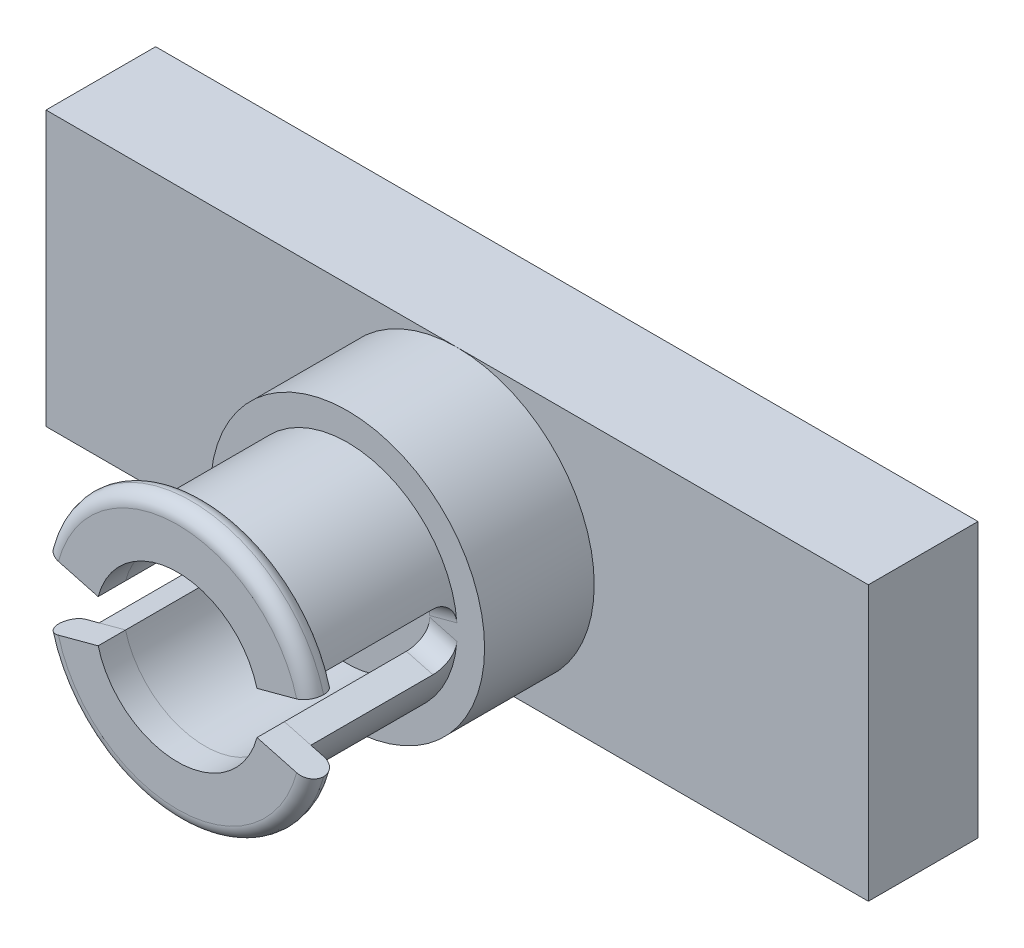
from build123d import *

# Parameters (mm, degrees)
SKETCH1_W             = 30
SKETCH1_H             = 4
BOSS_EXTRUDE1_DEPTH   = 10
SKETCH2_R             = 5
SKETCH2_R_2           = 4
BOSS_EXTRUDE2_DEPTH   = 4
BOSS_EXTRUDE3_DEPTH   = 5.2
BOSS_EXTRUDE5_DEPTH   = 1
BOSS_EXTRUDE5_2_DEPTH = 1
FILLET2_R             = 0.75
FILLET3_R             = 0.5
FILLET4_R             = 0.5


with BuildPart() as part:
    # Sketch1 → Boss-Extrude1 (new body)
    with BuildSketch(Plane(origin=(0, -120.095456241, 0), x_dir=(1, 0, 0), z_dir=(0, 1, 0))):
        with Locations((36.874415609, -119.024132807)):
            Rectangle(SKETCH1_W, SKETCH1_H)
    extrude(amount=BOSS_EXTRUDE1_DEPTH)

    # Sketch2 → Boss-Extrude2 (add)
    # profile 1 of 2: a face of its own
    with BuildSketch(Plane.XY.offset(121.024132807)):
        with Locations(Location((36.874415609, -115.095456241, 0), (0, 0, 270))):
            Circle(SKETCH2_R)
        with Locations((36.874415609, -115.095456241)):
            Circle(SKETCH2_R_2, mode=Mode.SUBTRACT)
    # profile 2 of 2: a face of its own
    with BuildSketch(Plane.XY.offset(121.024132807)):
        with Locations((36.874415609, -115.095456241)):
            Circle(SKETCH2_R_2)
    extrude(amount=BOSS_EXTRUDE2_DEPTH)

    # Sketch3 → Boss-Extrude3 (add)
    with BuildSketch(Plane.XY.offset(125.024132807)):
        with BuildLine():
            ThreePointArc((33.97663813, -114.318999106), (36.874415609, -112.095456241), (39.772193088, -114.318999106))
            Line((39.772193088, -114.318999106), (40.738118914, -114.060180061))
            ThreePointArc((40.738118914, -114.060180061), (36.874415609, -111.095456241), (33.010712304, -114.060180061))
            Line((33.010712304, -114.060180061), (33.97663813, -114.318999106))
        make_face()
        with BuildLine():
            Line((40.738118914, -116.130732422), (39.772193088, -115.871913377))
            ThreePointArc((39.772193088, -115.871913377), (36.874415609, -118.095456241), (33.97663813, -115.871913377))
            Line((33.97663813, -115.871913377), (33.010712304, -116.130732422))
            ThreePointArc((33.010712304, -116.130732422), (36.874415609, -119.095456241), (40.738118914, -116.130732422))
        make_face()
    extrude(amount=BOSS_EXTRUDE3_DEPTH)

    # Fillet2
    fillet2_edges = [part.edges().sort_by_distance(p)[0] for p in [
        (40.255156001, -114.189589584, 125.024132807),
        (33.493675217, -114.189589584, 125.024132807),
        (40.255156001, -116.001322899, 125.024132807),
        (33.493675217, -116.001322899, 125.024132807),
    ]]
    fillet(fillet2_edges, radius=FILLET2_R)


with BuildPart() as body_2:
    # Sketch5 → Boss-Extrude5 (new body)
    with BuildSketch(Plane.XY.offset(130.224132807)):
        with BuildLine():
            Line((33.010712304, -114.060180061), (33.97663813, -114.318999106))
            ThreePointArc((33.97663813, -114.318999106), (36.874415609, -112.095456241), (39.772193088, -114.318999106))
            Line((39.772193088, -114.318999106), (40.738118914, -114.060180061))
            Line((40.738118914, -114.060180061), (41.704044741, -113.801361016))
            ThreePointArc((41.704044741, -113.801361016), (36.874415609, -110.095456241), (32.044786478, -113.801361016))
            Line((32.044786478, -113.801361016), (33.010712304, -114.060180061))
        make_face()
    extrude(amount=BOSS_EXTRUDE5_DEPTH)

    # Fillet3
    fillet3_edges = [body_2.edges().sort_by_distance(p)[0] for p in [
        (36.874415609, -110.095456241, 130.224132807),
        (36.874415609, -110.095456241, 131.224132807),
    ]]
    fillet(fillet3_edges, radius=FILLET3_R - 0.0001)  # a hair under: the kernel refuses the full size


with BuildPart() as body_3:
    # Sketch5 → Boss-Extrude5 2 (new body)
    with BuildSketch(Plane.XY.offset(130.224132807)):
        with BuildLine():
            ThreePointArc((39.772193088, -115.871913377), (36.874415609, -118.095456241), (33.97663813, -115.871913377))
            Line((33.97663813, -115.871913377), (33.010712304, -116.130732422))
            Line((33.010712304, -116.130732422), (32.044786478, -116.389551467))
            ThreePointArc((32.044786478, -116.389551467), (36.874415609, -120.095456241), (41.704044741, -116.389551467))
            Line((41.704044741, -116.389551467), (40.738118914, -116.130732422))
            Line((40.738118914, -116.130732422), (39.772193088, -115.871913377))
        make_face()
    extrude(amount=BOSS_EXTRUDE5_2_DEPTH)

    # Fillet4
    fillet4_edges = [body_3.edges().sort_by_distance(p)[0] for p in [
        (36.874415609, -120.095456241, 130.224132807),
        (36.874415609, -120.095456241, 131.224132807),
    ]]
    fillet(fillet4_edges, radius=FILLET4_R - 0.0001)  # a hair under: the kernel refuses the full size


solid = Compound([part.part, body_2.part, body_3.part])
